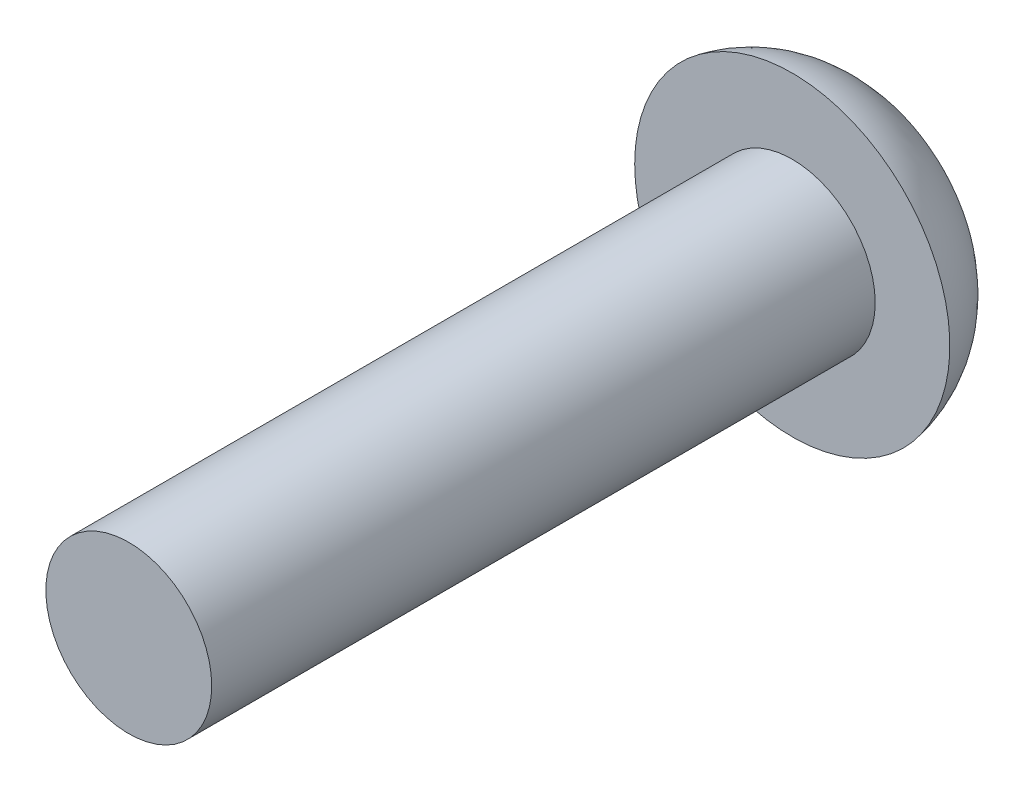
from build123d import *

# Parameters (mm, degrees)
SKETCH_1_R      = 1.5
EXTRUDE_1_DEPTH = 12
SKETCH_2_R      = 2.85
EXTRUDE_2_DEPTH = 1.65
FILLET_1_R      = 2


with BuildPart() as part:
    # 草图1 → 凸台-拉伸1 (new body)
    with BuildSketch(Plane.XY):
        Circle(SKETCH_1_R)
    extrude(amount=EXTRUDE_1_DEPTH)

    # 草图2 → 凸台-拉伸2 (add)
    with BuildSketch(Plane(origin=(0, 0, 0), x_dir=(-1, 0, 0), z_dir=(0, 0, -1))):
        Circle(SKETCH_2_R)
    extrude(amount=EXTRUDE_2_DEPTH)

    # 圆角1
    # the kernel refuses this fillet: 2 mm, written as the material it takes off along each edge
    with BuildSketch(Plane(origin=(0, 0, -1.65), x_dir=(-1, 0, 0), z_dir=(0, -1, 0))) as fillet_1_piece_1:
        with BuildLine():
            CenterArc((0.880863133, -2), FILLET_1_R, 10.078658108, 79.921341892)
            Line((0.880863133, 0), (0.880863133, 0.04))
            Line((0.880863133, 0.04), (2.85, 0.04))
            Line((2.85, 0.04), (2.89, 0))
            ThreePointArc((2.89, 0), (2.89, -0.825), (2.889382737, -1.643))
            Line((2.889382737, -1.643), (2.85, -1.65))
        make_face()
    revolve(axis=Axis((0, 0, -1.65), (0, 0, -1)), mode=Mode.SUBTRACT)


solid = part.part
